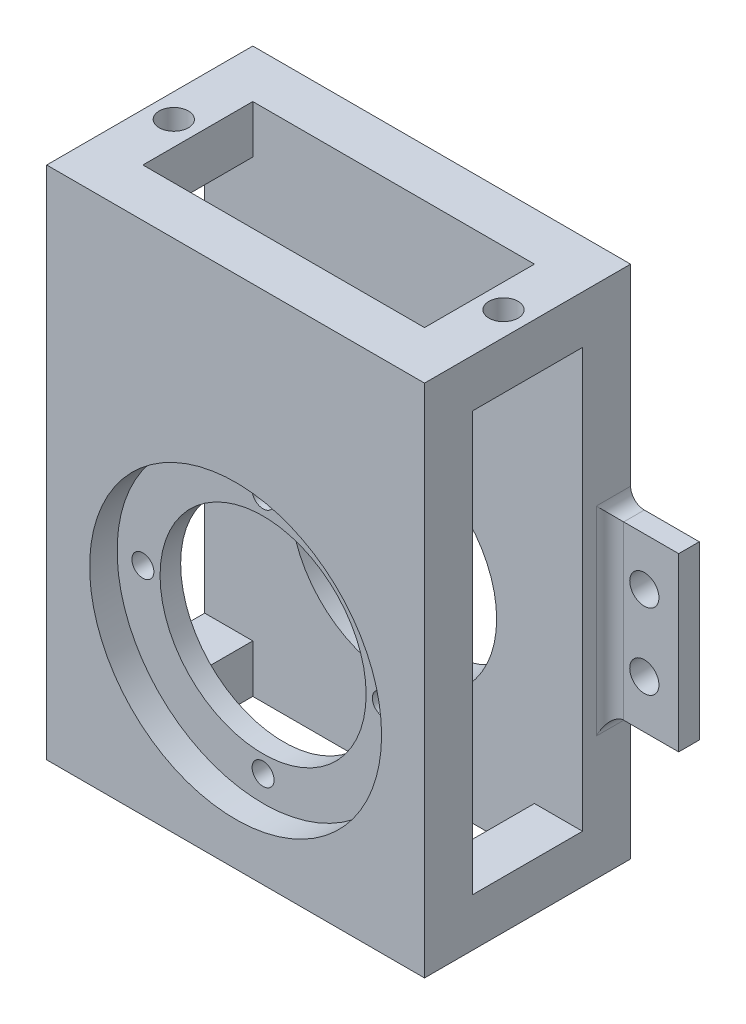
from build123d import *

# Parameters (mm, degrees)
SKETCH1_W           = 55
SKETCH1_H           = 75
BOSS_EXTRUDE1_DEPTH = 30
SKETCH4_W           = 41
SKETCH4_H           = 16
CUT_EXTRUDE1_DEPTH  = 86.330240829
SKETCH5_W           = 16
SKETCH5_H           = 61
CUT_EXTRUDE2_DEPTH  = 60
SKETCH7_R           = 21.25
CUT_EXTRUDE3_DEPTH  = 4
SKETCH8_R           = 15
CUT_EXTRUDE4_DEPTH  = 50
SKETCH9_R           = 1.6
CUT_EXTRUDE5_DEPTH  = 10
SKETCH11_R          = 2.125
CUT_EXTRUDE6_DEPTH  = 10
SKETCH15_W          = 10
SKETCH15_H          = 25
BOSS_EXTRUDE3_DEPTH = 3
SKETCH16_R          = 2.125
CUT_EXTRUDE8_DEPTH  = 3
FILLET2_R           = 2


with BuildPart() as part:
    # Sketch1 → Boss-Extrude1 (new body)
    with BuildSketch(Plane.XY):
        with Locations((0, 10)):
            Rectangle(SKETCH1_W, SKETCH1_H)
    extrude(amount=BOSS_EXTRUDE1_DEPTH)

    # Sketch4 → Cut-Extrude1 (cut, through all)
    with BuildSketch(Plane(origin=(0, 47.5, 0), x_dir=(1, 0, 0), z_dir=(0, 1, 0))):
        with Locations((0, -15)):
            Rectangle(SKETCH4_W, SKETCH4_H)
    extrude(amount=-CUT_EXTRUDE1_DEPTH, mode=Mode.SUBTRACT)

    # Sketch5 → Cut-Extrude2 (cut)
    with BuildSketch(Plane(origin=(27.5, 0, 0), x_dir=(0, 0, -1), z_dir=(1, 0, 0))):
        with Locations((-15, 10)):
            Rectangle(SKETCH5_W, SKETCH5_H)
    extrude(amount=-CUT_EXTRUDE2_DEPTH, mode=Mode.SUBTRACT)

    # Sketch7 → Cut-Extrude3 (cut)
    with BuildSketch(Plane.XY.offset(30)):
        Circle(SKETCH7_R)
    extrude(amount=-CUT_EXTRUDE3_DEPTH, mode=Mode.SUBTRACT)

    # Sketch8 → Cut-Extrude4 (cut)
    with BuildSketch(Plane.XY.offset(26)):
        Circle(SKETCH8_R)
    extrude(amount=-CUT_EXTRUDE4_DEPTH, mode=Mode.SUBTRACT)

    # Sketch9 → Cut-Extrude5 (cut)
    with BuildSketch(Plane.XY.offset(26)):
        with Locations((0, 17.5)):
            Circle(SKETCH9_R)
        with Locations((17.5, 0)):
            Circle(SKETCH9_R)
        with Locations((0, -17.5)):
            Circle(SKETCH9_R)
        with Locations((-17.5, 0)):
            Circle(SKETCH9_R)
    extrude(amount=-CUT_EXTRUDE5_DEPTH, mode=Mode.SUBTRACT)

    # Sketch11 → Cut-Extrude6 (cut)
    with BuildSketch(Plane(origin=(0, 47.5, 0), x_dir=(1, 0, 0), z_dir=(0, 1, 0))):
        with Locations((-24, -15)):
            Circle(SKETCH11_R)
        with Locations((24, -15)):
            Circle(SKETCH11_R)
    extrude(amount=-CUT_EXTRUDE6_DEPTH, mode=Mode.SUBTRACT)

    # Sketch15 → Boss-Extrude3 (add)
    with BuildSketch(Plane(origin=(0, 0, 0), x_dir=(-1, 0, 0), z_dir=(0, 0, -1))):
        with Locations((-32.5, 5)):
            Rectangle(SKETCH15_W, SKETCH15_H)
        with Locations((32.5, 5)):
            Rectangle(SKETCH15_W, SKETCH15_H)
    extrude(amount=-BOSS_EXTRUDE3_DEPTH)

    # Sketch16 → Cut-Extrude8 (cut)
    with BuildSketch(Plane(origin=(0, 0, 0), x_dir=(-1, 0, 0), z_dir=(0, 0, -1))):
        with Locations((-32.5, 10.5)):
            Circle(SKETCH16_R)
        with Locations((-32.5, -0.5)):
            Circle(SKETCH16_R)
        with Locations((32.5, -0.5)):
            Circle(SKETCH16_R)
        with Locations((32.5, 10.5)):
            Circle(SKETCH16_R)
    extrude(amount=-CUT_EXTRUDE8_DEPTH, mode=Mode.SUBTRACT)

    # Fillet2
    fillet2_edges = [part.edges().sort_by_distance(p)[0] for p in [
        (27.5, -7.5, 1.5),
        (27.5, 5, 3),
        (27.5, 17.5, 1.5),
        (-27.5, -7.5, 1.5),
        (-27.5, 5, 3),
        (-27.5, 17.5, 1.5),
    ]]
    fillet(fillet2_edges, radius=FILLET2_R)


solid = part.part
